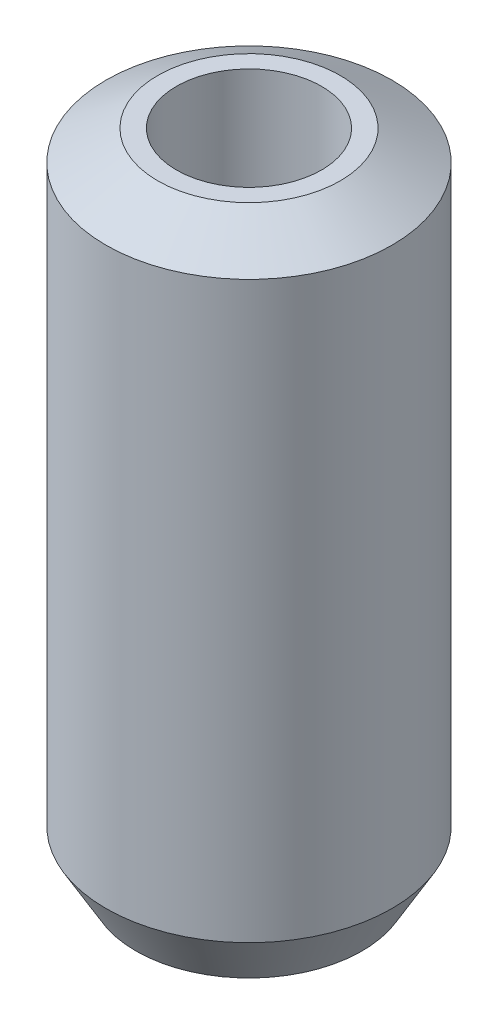
from build123d import *
from OCP.BRepFilletAPI import BRepFilletAPI_MakeChamfer

# Parameters (mm, degrees)
SKETCH1_R           = 7.5
BOSS_EXTRUDE1_DEPTH = 34.406526219
SKETCH2_R           = 3.805813698
CUT_EXTRUDE1_DEPTH  = 37.004292056
CHAMFER1_SIZE       = 1.56612686
CHAMFER1_SIZE2      = 2.712611292


with BuildPart() as part:
    # Sketch1 → Boss-Extrude1 (new body)
    with BuildSketch(Plane(origin=(0, 0, 0), x_dir=(1, 0, 0), z_dir=(0, 1, 0))):
        Circle(SKETCH1_R)
    extrude(amount=BOSS_EXTRUDE1_DEPTH)

    # Sketch2 → Cut-Extrude1 (cut, through all)
    with BuildSketch(Plane(origin=(0, 0, 0), x_dir=(1, 0, 0), z_dir=(0, 1, 0))):
        Circle(SKETCH2_R)
    extrude(amount=CUT_EXTRUDE1_DEPTH, mode=Mode.SUBTRACT)

    # Chamfer1: one chamfer whose edges measure the first distance from different faces: ONE call of the kernel's chamfer builder (chamfer() names one face for all edges)
    chamfer1_edges_1 = [part.edges().sort_by_distance(p)[0] for p in [
        (-7.5, 34.406526219, 0),
    ]]
    chamfer1_side_1 = [part.faces().sort_by_distance(p)[0] for p in [
        (-7.5, 17.203263109, 0),
    ]]
    chamfer1_edges_2 = [part.edges().sort_by_distance(p)[0] for p in [
        (-7.5, 0, 0),
    ]]
    chamfer1_side_2 = [part.faces().sort_by_distance(p)[0] for p in [
        (-7.287867966, 0, 0),
    ]]
    chamfer1 = BRepFilletAPI_MakeChamfer(part.part.solid().wrapped)
    for e in chamfer1_edges_1:
        chamfer1.Add(CHAMFER1_SIZE, CHAMFER1_SIZE2, e.wrapped, chamfer1_side_1[0].wrapped)  # the first distance lies on this face
    for e in chamfer1_edges_2:
        chamfer1.Add(CHAMFER1_SIZE, CHAMFER1_SIZE2, e.wrapped, chamfer1_side_2[0].wrapped)  # the first distance lies on this face
    add(Compound.cast(chamfer1.Shape()), mode=Mode.REPLACE)


solid = part.part
